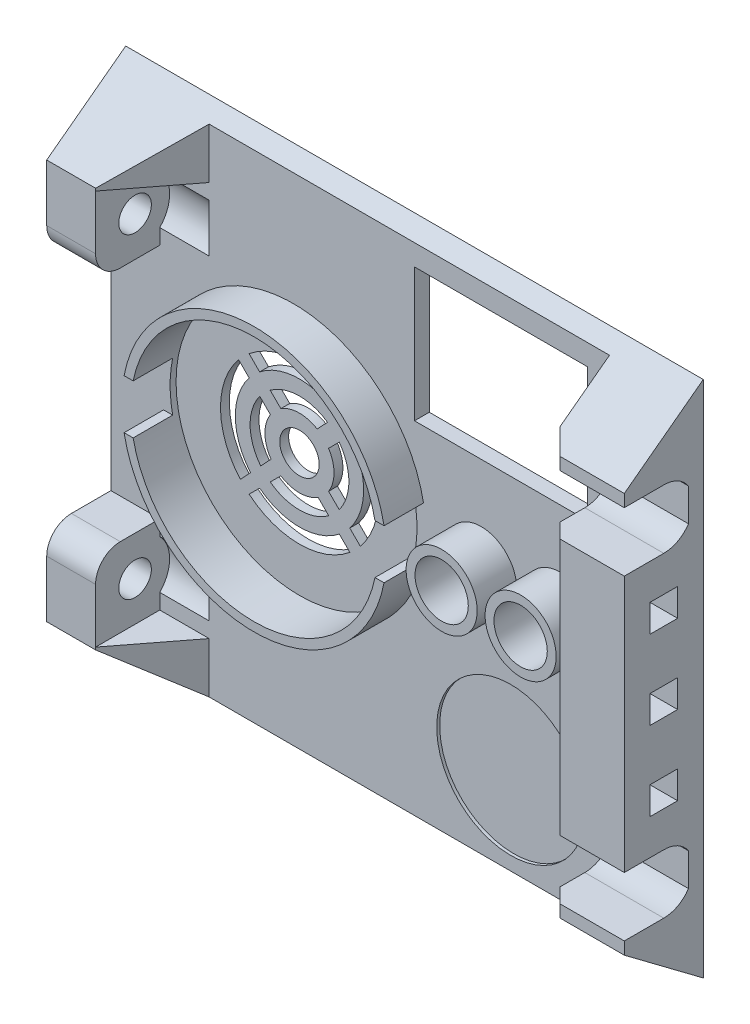
from build123d import *
from build123d.topology import SkipClean

# Parameters (mm, degrees)
ESBO_O1_R                 = 8.3
RESSALTO_EXTRUS_O1_DEPTH  = 1.5
RESSALTO_EXTRUS_O2_DEPTH  = 6
ESBO_O3_W                 = 2.8
ESBO_O3_H                 = 2.8
CORTE_EXTRUS_O1_DEPTH     = 37.142080737
ESBO_O4_W                 = 2.8
ESBO_O4_H                 = 2.8
CORTE_EXTRUS_O2_DEPTH     = 53.08166664
ESBO_O6_W                 = 5
ESBO_O6_H                 = 25
RESSALTO_EXTRUS_O5_DEPTH  = 7.5
ESBO_O7_W                 = 2.8
ESBO_O7_H                 = 2.8
CORTE_EXTRUS_O3_DEPTH     = 60
RESSALTO_EXTRUS_O3_DEPTH  = 10
ESBO_O8_W                 = 60
ESBO_O8_H                 = 52.5
ESBO_O8_R                 = 8.3
RESSALTO_EXTRUS_O6_DEPTH  = 1.5
CORTE_EXTRUS_O4_DEPTH     = 42.098205557
RESSALTO_EXTRUS_O7_DEPTH  = 6.5
ESBO_O14_W                = 5.7
ESBO_O14_H                = 52.5
CORTE_EXTRUS_O8_DEPTH     = 4.5
CORTE_EXTRUS_O9_DEPTH     = 41.657871317
CORTE_EXTRUS_O13_DEPTH    = 6.25
CORTE_EXTRUS_O14_DEPTH    = 6.25
ESBO_O12_R                = 1.65
CORTE_EXTRUS_O15_DEPTH    = 4.5
CORTE_EXTRUS_O17_DEPTH    = 62.398717413
ESBO_O20_R                = 3.5
CORTE_EXTRUS_O18_DEPTH    = 5
RESSALTO_EXTRUS_O8_START  = 2.95
ESBO_O21_R                = 1.65
RESSALTO_EXTRUS_O8_DEPTH  = 2.95
ESBO_O22_W                = 2.8
ESBO_O22_H                = 2.8
RESSALTO_EXTRUS_O9_DEPTH  = 1.25
CORTE_EXTRUS_O19_DEPTH    = 6
ESBO_O24_W                = 8
ESBO_O24_H                = 50.25
RESSALTO_EXTRUS_O10_DEPTH = 6.5
CORTE_EXTRUS_O20_DEPTH    = 62.222570389
CORTE_EXTRUS_O21_REACH    = 67.143
ESBO_O26_W                = 2.8
ESBO_O26_H                = 2.8
CORTE_EXTRUS_O22_REACH    = 67.143
CORTE_EXTRUS_O23_DEPTH    = 6.5
CORTE_EXTRUS_O24_DEPTH    = 6.5
CORTE_EXTRUS_O25_START    = -6.5
CORTE_EXTRUS_O25_DEPTH    = 6.5
CORTE_EXTRUS_O26_DEPTH    = 4.95
ESBO_O33_R                = 9.3
CORTE_EXTRUS_O27_DEPTH    = 43.019340785
ESBO_O34_R                = 8.3
RESSALTO_EXTRUS_O11_DEPTH = 1.5
RESSALTO_EXTRUS_O12_DEPTH = 4
CORTE_EXTRUS_O31_DEPTH    = 42.326444318
CORTE_EXTRUS_O32_START    = -0.6
ESBO_O42_R                = 12.5
CORTE_EXTRUS_O32_DEPTH    = 0.6
ESBO_O43_W                = 17.5
ESBO_O43_H                = 13.5
CORTE_EXTRUS_O33_DEPTH    = 42.326444318
ESBO_O44_R                = 7.5
CORTE_EXTRUS_O34_DEPTH    = 0.3
ESBO_O45_R                = 2.7
CORTE_EXTRUS_O35_DEPTH    = 42.326444318
ESBO_O46_R                = 3
CORTE_EXTRUS_O36_DEPTH    = 42.374690331
CHANFRO1_SIZE             = 1
ESBO_O47_R                = 3
RESSALTO_EXTRUS_O13_DEPTH = 1.2
CHANFRO2_SIZE             = 1
RESSALTO_EXTRUS_O14_START = 4
ESBO_O48_R                = 3.6
ESBO_O48_R_2              = 2.7
RESSALTO_EXTRUS_O14_DEPTH = 4


with BuildPart() as part:
    # Esboço1 → Ressalto-extrusão1 (new body)
    with BuildSketch(Plane.XY):
        Polygon((-25, -12.5), (-25, 12.5), (25, 12.5), (25, -12.5), (15, -12.5), (-15, -12.5), align=None)
        with Locations((-13, 0)):
            Circle(ESBO_O1_R, mode=Mode.SUBTRACT)
        with Locations(Location((13, 0, 0), (0, 0, 180))):
            Circle(ESBO_O1_R, mode=Mode.SUBTRACT)
    extrude(amount=RESSALTO_EXTRUS_O1_DEPTH)

    # Esboço2 → Ressalto-extrusão2 (add)
    with BuildSketch(Plane.XY.offset(1.5)):
        Polygon((-20, -12.5), (-25, -12.5), (-25, -2.5), (-22, -2.5), (-22, -9.5), (-15, -9.5), (-15, -12.5), align=None)
        Polygon((22, -2.5), (22, -9.5), (15, -9.5), (15, -12.5), (20, -12.5), (25, -12.5), (25, -2.5), align=None)
        Polygon((20, 12.5), (25, 12.5), (25, 2.5), (22, 2.5), (22, 9.5), (15, 9.5), (15, 12.5), align=None)
        Polygon((-22, 2.5), (-22, 9.5), (-15, 9.5), (-15, 12.5), (-20, 12.5), (-25, 12.5), (-25, 2.5), align=None)
    extrude(amount=RESSALTO_EXTRUS_O2_DEPTH)

    # Esboço3 → Corte-extrusão1 (cut, through all)
    with BuildSketch(Plane.XZ.offset(12.5)):
        with Locations((-20, 3.75)):
            Rectangle(ESBO_O3_W, ESBO_O3_H)
        with Locations((20, 3.75)):
            Rectangle(ESBO_O3_W, ESBO_O3_H)
    extrude(amount=-CORTE_EXTRUS_O1_DEPTH, mode=Mode.SUBTRACT)

    # Esboço4 → Corte-extrusão2 (cut, through all)
    with BuildSketch(Plane.ZY.offset(25)):
        with Locations((3.75, 7.5)):
            Rectangle(ESBO_O4_W, ESBO_O4_H)
        with Locations((3.75, -7.5)):
            Rectangle(ESBO_O4_W, ESBO_O4_H)
    extrude(amount=-CORTE_EXTRUS_O2_DEPTH, mode=Mode.SUBTRACT)

    # Esboço6 → Ressalto-extrusão5 (add)
    with BuildSketch(Plane(origin=(0, 0, 0), x_dir=(-1, 0, 0), z_dir=(0, 0, -1))):
        with Locations((-27.5, 0)):
            Rectangle(ESBO_O6_W, ESBO_O6_H)
        with Locations((27.5, 0)):
            Rectangle(ESBO_O6_W, ESBO_O6_H)
    extrude(amount=-RESSALTO_EXTRUS_O5_DEPTH)

    # Esboço7 → Corte-extrusão3 (cut)
    with BuildSketch(Plane(origin=(30, 0, 0), x_dir=(0, 0, -1), z_dir=(1, 0, 0))):
        with Locations((-3.75, -7.5)):
            Rectangle(ESBO_O7_W, ESBO_O7_H)
        with Locations((-3.75, 7.5)):
            Rectangle(ESBO_O7_W, ESBO_O7_H)
    extrude(amount=-CORTE_EXTRUS_O3_DEPTH, mode=Mode.SUBTRACT)

    # Esboço5 → Ressalto-extrusão3 (add)
    with SkipClean():  # the faces are left unmerged after this step: merging them gives an invalid solid
        with BuildSketch(Plane.XY.offset(1.5)):
            with BuildLine():
                Line((-9, -7.272551134), (-9, -8.395832299))
                ThreePointArc((-9, -8.395832299), (-3.7, 0), (-9, 8.395832299))
                Line((-9, 8.395832299), (-9, 7.272551134))
                ThreePointArc((-9, 7.272551134), (-4.7, 0), (-9, -7.272551134))
            make_face()
            with BuildLine():
                Line((-17, -7.272551134), (-17, -8.395832299))
                ThreePointArc((-17, -8.395832299), (-22.3, 0), (-17, 8.395832299))
                Line((-17, 8.395832299), (-17, 7.272551134))
                ThreePointArc((-17, 7.272551134), (-21.3, 0), (-17, -7.272551134))
            make_face()
            with BuildLine():
                Line((9, -7.272551134), (9, -8.395832299))
                ThreePointArc((9, -8.395832299), (3.7, 0), (9, 8.395832299))
                Line((9, 8.395832299), (9, 7.272551134))
                ThreePointArc((9, 7.272551134), (4.7, 0), (9, -7.272551134))
            make_face()
            with BuildLine():
                Line((17, 8.395832299), (17, 7.272551134))
                ThreePointArc((17, 7.272551134), (21.3, 0), (17, -7.272551134))
                Line((17, -7.272551134), (17, -8.395832299))
                ThreePointArc((17, -8.395832299), (22.3, 0), (17, 8.395832299))
            make_face()
        extrude(amount=RESSALTO_EXTRUS_O3_DEPTH)

    # Esboço8 → Ressalto-extrusão6 (add)
    with SkipClean():  # the faces are left unmerged after this step: merging them gives an invalid solid
        with BuildSketch(Plane(origin=(0, 0, 0), x_dir=(-1, 0, 0), z_dir=(0, 0, -1))):
            Rectangle(ESBO_O8_W, ESBO_O8_H)
            with Locations(Location((13, 0, 0), (0, 0, 298.811379709))):
                Circle(ESBO_O8_R, mode=Mode.SUBTRACT)
            with Locations((-13, 0)):
                Circle(ESBO_O8_R, mode=Mode.SUBTRACT)
        extrude(amount=-RESSALTO_EXTRUS_O6_DEPTH)

    # Esboço9 → Corte-extrusão4 (cut, through all)
    with SkipClean():  # the faces are left unmerged after this step: merging them gives an invalid solid
        with BuildSketch(Plane.XY.offset(1.5)):
            Polygon((-15, -12.5), (-15, -9.5), (-22, -9.5), (-22, -2.5), (-25, -2.5), (-25, 2.5), (-22, 2.5), (-22, 9.5), (-15, 9.5), (-15, 12.5), (-30, 12.5), (-30, -12.5), align=None)
        extrude(amount=CORTE_EXTRUS_O4_DEPTH, mode=Mode.SUBTRACT)

    # Esboço10 → Ressalto-extrusão7 (add)
    with SkipClean():  # the faces are left unmerged after this step: merging them gives an invalid solid
        with BuildSketch(Plane.XY.offset(1.5)):
            Polygon((-24.3, -26.25), (-24.3, 26.25), (-22.3, 26.25), (-17.3, 26.25), (-17.3, 20), (-22.3, 20), (-22.3, 12), (-17.3, 12), (-17.3, -12), (-22.3, -12), (-22.3, -20), (-17.3, -20), (-17.3, -26.25), (-22.3, -26.25), align=None)
        extrude(amount=RESSALTO_EXTRUS_O7_DEPTH)

    # Esboço14 → Corte-extrusão8 (cut)
    with SkipClean():  # the faces are left unmerged after this step: merging them gives an invalid solid
        with BuildSketch(Plane.XY.offset(1.5)):
            with Locations((-27.15, 0)):
                Rectangle(ESBO_O14_W, ESBO_O14_H)
        extrude(amount=-CORTE_EXTRUS_O8_DEPTH, mode=Mode.SUBTRACT)

    # Esboço15 → Corte-extrusão9 (cut, through all)
    with SkipClean():  # the faces are left unmerged after this step: merging them gives an invalid solid
        with BuildSketch(Plane.XY.offset(8)):
            with BuildLine():
                Line((-17.3, -7.09929574), (-17.3, 7.09929574))
                ThreePointArc((-17.3, 7.09929574), (-21.3, 0), (-17.3, -7.09929574))
            make_face()
        extrude(amount=-CORTE_EXTRUS_O9_DEPTH, mode=Mode.SUBTRACT)

    # Esboço11 → Corte-extrusão13 (cut)
    with SkipClean():  # the faces are left unmerged after this step: merging them gives an invalid solid
        with BuildSketch(Plane.XZ.offset(26.25)):
            Polygon((-22.3, 8), (-17.3, 8), (-17.3, 1.5), align=None)
        extrude(amount=-CORTE_EXTRUS_O13_DEPTH, mode=Mode.SUBTRACT)

    # Esboço17 → Corte-extrusão14 (cut)
    with SkipClean():  # the faces are left unmerged after this step: merging them gives an invalid solid
        with BuildSketch(Plane(origin=(0, 26.25, 0), x_dir=(1, 0, 0), z_dir=(0, 1, 0))):
            Polygon((-17.3, -1.5), (-17.3, -8), (-22.3, -8), align=None)
        extrude(amount=-CORTE_EXTRUS_O14_DEPTH, mode=Mode.SUBTRACT)

    # Esboço12 → Corte-extrusão15 (cut)
    with SkipClean():  # the faces are left unmerged after this step: merging them gives an invalid solid
        with BuildSketch(Plane.ZY.offset(24.3)):
            with Locations(Location((4, 16, 0), (0, 0, 270))):
                Circle(ESBO_O12_R)
            with Locations((4, -16)):
                Circle(ESBO_O12_R)
        extrude(amount=-CORTE_EXTRUS_O15_DEPTH, mode=Mode.SUBTRACT)

    # Esboço19 → Corte-extrusão17 (cut, through all)
    with SkipClean():  # the faces are left unmerged after this step: merging them gives an invalid solid
        with BuildSketch(Plane.ZY.offset(24.3)):
            Polygon((0, 26.25), (8, 26.25), (8, 20.25), align=None)
            Polygon((8, -20.25), (0, -26.25), (8, -26.25), align=None)
        extrude(amount=-CORTE_EXTRUS_O17_DEPTH, mode=Mode.SUBTRACT)

    # Esboço20 → Corte-extrusão18 (cut)
    with SkipClean():  # the faces are left unmerged after this step: merging them gives an invalid solid
        with BuildSketch(Plane(origin=(-22.3, 0, 0), x_dir=(0, 0, -1), z_dir=(1, 0, 0))):
            with Locations((-4, -16)):
                Circle(ESBO_O20_R)
            with Locations((-4, 16)):
                Circle(ESBO_O20_R)
        extrude(amount=CORTE_EXTRUS_O18_DEPTH, mode=Mode.SUBTRACT)

    # Esboço21 → Ressalto-extrusão8 (add)
    with SkipClean():  # the faces are left unmerged after this step: merging them gives an invalid solid
        with BuildSketch(Plane.ZY.offset(24.3).offset(RESSALTO_EXTRUS_O8_START)):
            Polygon((0, 26.25), (0, -26.25), (8, -20.25), (8, 20.25), align=None)
            with Locations(Location((4, -16, 0), (0, 0, 270))):
                Circle(ESBO_O21_R, mode=Mode.SUBTRACT)
            with Locations(Location((4, 16, 0), (0, 0, 270))):
                Circle(ESBO_O21_R, mode=Mode.SUBTRACT)
        extrude(amount=-RESSALTO_EXTRUS_O8_DEPTH)

    # Esboço22 → Ressalto-extrusão9 (add)
    with SkipClean():  # the faces are left unmerged after this step: merging them gives an invalid solid
        with BuildSketch(Plane(origin=(30, 0, 0), x_dir=(0, 0, -1), z_dir=(1, 0, 0))):
            Polygon((-1.5, -25.125), (0, -26.25), (0, 26.25), (-1.5, 25.125), (-1.5, 12.5), (-7.5, 12.5), (-7.5, -12.5), (-1.5, -12.5), align=None)
            with Locations((-3.75, -7.5)):
                Rectangle(ESBO_O22_W, ESBO_O22_H, mode=Mode.SUBTRACT)
            with Locations((-3.75, 7.5)):
                Rectangle(ESBO_O22_W, ESBO_O22_H, mode=Mode.SUBTRACT)
        extrude(amount=RESSALTO_EXTRUS_O9_DEPTH)

    # Esboço23 → Corte-extrusão19 (cut)
    with SkipClean():  # the faces are left unmerged after this step: merging them gives an invalid solid
        with BuildSketch(Plane.XY.offset(7.5)):
            Polygon((25, -2.5), (22, -2.5), (22, -9.5), (15, -9.5), (15, -12.5), (31.25, -12.5), (31.25, 12.5), (15, 12.5), (15, 9.5), (22, 9.5), (22, 2.5), (25, 2.5), align=None)
        extrude(amount=-CORTE_EXTRUS_O19_DEPTH, mode=Mode.SUBTRACT)

    # Esboço24 → Ressalto-extrusão10 (add)
    with SkipClean():  # the faces are left unmerged after this step: merging them gives an invalid solid
        with BuildSketch(Plane.XY.offset(1.5)):
            with Locations((27.25, 0)):
                Rectangle(ESBO_O24_W, ESBO_O24_H)
        extrude(amount=RESSALTO_EXTRUS_O10_DEPTH)

    # Esboço25 → Corte-extrusão20 (cut, through all)
    with SkipClean():  # the faces are left unmerged after this step: merging them gives an invalid solid
        with BuildSketch(Plane(origin=(0, 25.125, 0), x_dir=(1, 0, 0), z_dir=(0, 1, 0))):
            Polygon((23.25, -6.5), (23.25, -8), (24.75, -8), align=None)
        extrude(amount=-CORTE_EXTRUS_O20_DEPTH, mode=Mode.SUBTRACT)

    # Esboço26 → Corte-extrusão21 (cut, up to next)
    with BuildSketch(Plane(origin=(31.25, 0, 0), x_dir=(0, 0, -1), z_dir=(1, 0, 0)), mode=Mode.PRIVATE) as corte_extrus_o21_sk1:
        with Locations((-4, 0)):
            Rectangle(ESBO_O26_W, ESBO_O26_H)
    corte_extrus_o21_tool1 = extrude(corte_extrus_o21_sk1.sketch, amount=-CORTE_EXTRUS_O21_REACH, mode=Mode.PRIVATE) & part.part
    # Esboço26 → Corte-extrusão21 (cut, up to next)
    with BuildSketch(Plane(origin=(31.25, 0, 0), x_dir=(0, 0, -1), z_dir=(1, 0, 0)), mode=Mode.PRIVATE) as corte_extrus_o21_sk2:
        with Locations((-4, -8)):
            Rectangle(ESBO_O26_W, ESBO_O26_H)
    corte_extrus_o21_tool2 = extrude(corte_extrus_o21_sk2.sketch, amount=-CORTE_EXTRUS_O21_REACH, mode=Mode.PRIVATE) & part.part
    # Esboço26 → Corte-extrusão21 (cut, up to next)
    with BuildSketch(Plane(origin=(31.25, 0, 0), x_dir=(0, 0, -1), z_dir=(1, 0, 0)), mode=Mode.PRIVATE) as corte_extrus_o21_sk3:
        with Locations((-4, 8)):
            Rectangle(ESBO_O26_W, ESBO_O26_H)
    corte_extrus_o21_tool3 = extrude(corte_extrus_o21_sk3.sketch, amount=-CORTE_EXTRUS_O21_REACH, mode=Mode.PRIVATE) & part.part
    add(corte_extrus_o21_tool1.solids().sort_by_distance((31.25, 0, 4))[0], mode=Mode.SUBTRACT)
    add(corte_extrus_o21_tool2.solids().sort_by_distance((31.25, -8, 4))[0], mode=Mode.SUBTRACT)
    add(corte_extrus_o21_tool3.solids().sort_by_distance((31.25, 8, 4))[0], mode=Mode.SUBTRACT)

    # Esboço27 → Corte-extrusão22 (cut, up to next)
    with BuildSketch(Plane(origin=(31.25, 0, 0), x_dir=(0, 0, -1), z_dir=(1, 0, 0)), mode=Mode.PRIVATE) as corte_extrus_o22_sk1:
        with BuildLine():
            Line((-4, 19), (-8, 19))
            Line((-8, 19), (-8, 13))
            Line((-8, 13), (-4, 13))
            ThreePointArc((-4, 13), (-2.581362835, 13.356617963), (-1.5, 14.341687605))
            Line((-1.5, 14.341687605), (-1.5, 17.658312395))
            ThreePointArc((-1.5, 17.658312395), (-2.581362835, 18.643382037), (-4, 19))
        make_face()
    corte_extrus_o22_tool1 = extrude(corte_extrus_o22_sk1.sketch, amount=-CORTE_EXTRUS_O22_REACH, mode=Mode.PRIVATE) & part.part
    # Esboço27 → Corte-extrusão22 (cut, up to next)
    with BuildSketch(Plane(origin=(31.25, 0, 0), x_dir=(0, 0, -1), z_dir=(1, 0, 0)), mode=Mode.PRIVATE) as corte_extrus_o22_sk2:
        Polygon((-8, -20.25), (-8, -25.125), (-1.5, -25.125), align=None)
    corte_extrus_o22_tool2 = extrude(corte_extrus_o22_sk2.sketch, amount=-CORTE_EXTRUS_O22_REACH, mode=Mode.PRIVATE) & part.part
    # Esboço27 → Corte-extrusão22 (cut, up to next)
    with BuildSketch(Plane(origin=(31.25, 0, 0), x_dir=(0, 0, -1), z_dir=(1, 0, 0)), mode=Mode.PRIVATE) as corte_extrus_o22_sk3:
        Polygon((-8, 25.125), (-8, 20.25), (-1.5, 25.125), align=None)
    corte_extrus_o22_tool3 = extrude(corte_extrus_o22_sk3.sketch, amount=-CORTE_EXTRUS_O22_REACH, mode=Mode.PRIVATE) & part.part
    # Esboço27 → Corte-extrusão22 (cut, up to next)
    with BuildSketch(Plane(origin=(31.25, 0, 0), x_dir=(0, 0, -1), z_dir=(1, 0, 0)), mode=Mode.PRIVATE) as corte_extrus_o22_sk4:
        with BuildLine():
            Line((-4, -13), (-8, -13))
            Line((-8, -13), (-8, -19))
            Line((-8, -19), (-4, -19))
            ThreePointArc((-4, -19), (-2.581362835, -18.643382037), (-1.5, -17.658312395))
            Line((-1.5, -17.658312395), (-1.5, -14.341687605))
            ThreePointArc((-1.5, -14.341687605), (-2.581362835, -13.356617963), (-4, -13))
        make_face()
    corte_extrus_o22_tool4 = extrude(corte_extrus_o22_sk4.sketch, amount=-CORTE_EXTRUS_O22_REACH, mode=Mode.PRIVATE) & part.part
    add(corte_extrus_o22_tool1.solids().sort_by_distance((31.25, 16, 4.892695))[0], mode=Mode.SUBTRACT)
    add(corte_extrus_o22_tool2.solids().sort_by_distance((31.25, -23.5, 5.833333))[0], mode=Mode.SUBTRACT)
    add(corte_extrus_o22_tool3.solids().sort_by_distance((31.25, 23.5, 5.833333))[0], mode=Mode.SUBTRACT)
    add(corte_extrus_o22_tool4.solids().sort_by_distance((31.25, -16, 4.892695))[0], mode=Mode.SUBTRACT)

    # Esboço28 → Corte-extrusão23 (cut)
    with SkipClean():  # the faces are left unmerged after this step: merging them gives an invalid solid
        with BuildSketch(Plane.XY.offset(8)):
            with BuildLine():
                Line((-27.25, 12), (-27.25, -12))
                Line((-27.25, -12), (-24.8, -12))
                ThreePointArc((-24.8, -12), (-23.032233047, -11.267766953), (-22.3, -9.5))
                Line((-22.3, -9.5), (-22.3, 9.5))
                ThreePointArc((-22.3, 9.5), (-23.032233047, 11.267766953), (-24.8, 12))
                Line((-24.8, 12), (-27.25, 12))
            make_face()
        extrude(amount=-CORTE_EXTRUS_O23_DEPTH, mode=Mode.SUBTRACT)

    # Esboço29 → Corte-extrusão24 (cut)
    with SkipClean():  # the faces are left unmerged after this step: merging them gives an invalid solid
        with BuildSketch(Plane.XY.offset(8)):
            with BuildLine():
                Line((-19.8, -12), (-19.8, -12.44923286))
                Line((-19.8, -12.44923286), (-19.8, -14.139655276))
                Line((-19.8, -14.139655276), (-15.225886581, -14.139655276))
                Line((-15.225886581, -14.139655276), (-15.225886581, -9.5))
                Line((-15.225886581, -9.5), (-17.3, -9.5))
                ThreePointArc((-17.3, -9.5), (-18.032233047, -11.267766953), (-19.8, -12))
            make_face()
            with BuildLine():
                Line((-19.8, 12), (-19.8, 12.907103379))
                Line((-19.8, 12.907103379), (-15.750500434, 12.907103379))
                Line((-15.750500434, 12.907103379), (-15.750500434, 9.5))
                Line((-15.750500434, 9.5), (-17.3, 9.5))
                ThreePointArc((-17.3, 9.5), (-18.032233047, 11.267766953), (-19.8, 12))
            make_face()
        extrude(amount=-CORTE_EXTRUS_O24_DEPTH, mode=Mode.SUBTRACT)

    # Esboço30 → Corte-extrusão25 (cut)
    with SkipClean():  # the faces are left unmerged after this step: merging them gives an invalid solid
        with BuildSketch(Plane.XY.offset(8).offset(CORTE_EXTRUS_O25_START)):
            with BuildLine():
                Line((-27.25, 12), (-17, 12))
                Line((-17, 12), (-17, 8.395832299))
                ThreePointArc((-17, 8.395832299), (-22.3, 0), (-17, -8.395832299))
                Line((-17, -8.395832299), (-17, -12))
                Line((-17, -12), (-27.25, -12))
                Line((-27.25, -12), (-27.25, 12))
            make_face()
        extrude(amount=CORTE_EXTRUS_O25_DEPTH, mode=Mode.SUBTRACT)

    # Esboço31 → Corte-extrusão26 (cut)
    with SkipClean():  # the faces are left unmerged after this step: merging them gives an invalid solid
        with BuildSketch(Plane.ZY.offset(27.25)):
            with BuildLine():
                Line((5.5, -12), (8, -12))
                Line((8, -12), (8, -14.5))
                ThreePointArc((8, -14.5), (7.267766953, -12.732233047), (5.5, -12))
            make_face()
            with BuildLine():
                Line((5.5, 12), (8, 12))
                Line((8, 12), (8, 14.5))
                ThreePointArc((8, 14.5), (7.267766953, 12.732233047), (5.5, 12))
            make_face()
        extrude(amount=-CORTE_EXTRUS_O26_DEPTH, mode=Mode.SUBTRACT)

    # Esboço33 → Corte-extrusão27 (cut, through all)
    with BuildSketch(Plane.XY.offset(1.5)):
        with Locations((13, 0)):
            Circle(ESBO_O33_R)
        with Locations((-13, 0)):
            Circle(ESBO_O33_R)
    extrude(amount=CORTE_EXTRUS_O27_DEPTH, mode=Mode.SUBTRACT)

    # Esboço34 → Ressalto-extrusão11 (add)
    with BuildSketch(Plane(origin=(0, 0, 0), x_dir=(-1, 0, 0), z_dir=(0, 0, -1))):
        with Locations((-13, 0)):
            Circle(ESBO_O34_R)
        with Locations((13, 0)):
            Circle(ESBO_O34_R)
    extrude(amount=-RESSALTO_EXTRUS_O11_DEPTH)

    # Esboço35 → Ressalto-extrusão12 (add)
    with BuildSketch(Plane.XY.offset(1.5)):
        with BuildLine():
            Line((3.497448714, -2.25), (4.414725595, -2.25))
            ThreePointArc((4.414725595, -2.25), (-8.75, -13.15), (-21.914725595, -2.25))
            Line((-21.914725595, -2.25), (-20.997448714, -2.25))
            ThreePointArc((-20.997448714, -2.25), (-8.75, -12.25), (3.497448714, -2.25))
        make_face()
        with BuildLine():
            Line((-21.914725595, 2.75), (-20.997448714, 2.75))
            ThreePointArc((-20.997448714, 2.75), (-8.75, 12.75), (3.497448714, 2.75))
            Line((3.497448714, 2.75), (4.414725595, 2.75))
            ThreePointArc((4.414725595, 2.75), (-8.75, 13.65), (-21.914725595, 2.75))
        make_face()
    extrude(amount=RESSALTO_EXTRUS_O12_DEPTH)

    # Esboço37 → Corte-extrusão31 (cut, through all)
    with BuildSketch(Plane.XY.offset(1.5)):
        with BuildLine():
            ThreePointArc((-10.591004853, 1.031473693), (-10.749669201, 0.213625746), (-10.561366127, -0.597910816))
            Line((-10.561366127, -0.597910816), (-9.787440649, 0.227909489))
            Line((-9.787440649, 0.227909489), (-10.591004853, 1.031473693))
        make_face()
        with BuildLine():
            Line((-10.591004853, 1.031473693), (-9.787440649, 0.227909489))
            Line((-9.787440649, 0.227909489), (-8.761187679, 1.322976863))
            Line((-8.761187679, 1.322976863), (-9.529887973, 2.091677157))
            ThreePointArc((-9.529887973, 2.091677157), (-10.163604487, 1.664822375), (-10.591004853, 1.031473693))
        make_face()
        with BuildLine():
            Line((-9.787440649, 0.227909489), (-10.561366127, -0.597910816))
            ThreePointArc((-10.561366127, -0.597910816), (-10.137698974, -1.190240104), (-9.530041031, -1.591612334))
            Line((-9.530041031, -1.591612334), (-8.748979928, -0.810551231))
            Line((-8.748979928, -0.810551231), (-9.787440649, 0.227909489))
        make_face()
        Polygon((-8.761187679, 1.322976863), (-9.787440649, 0.227909489), (-8.748979928, -0.810551231), (-7.688319756, 0.25010894), align=None)
        with BuildLine():
            Line((-7.688319756, 0.25010894), (-8.748979928, -0.810551231))
            Line((-8.748979928, -0.810551231), (-7.968526307, -1.591004853))
            ThreePointArc((-7.968526307, -1.591004853), (-7.335177625, -1.163604487), (-6.908322843, -0.529887973))
            Line((-6.908322843, -0.529887973), (-7.688319756, 0.25010894))
        make_face()
        with BuildLine():
            Line((-8.021267648, 2.112511519), (-8.761187679, 1.322976863))
            Line((-8.761187679, 1.322976863), (-7.688319756, 0.25010894))
            Line((-7.688319756, 0.25010894), (-6.908387666, 1.030041031))
            ThreePointArc((-6.908387666, 1.030041031), (-7.355509577, 1.683665393), (-8.021267648, 2.112511519))
        make_face()
        with BuildLine():
            Line((-6.908387666, 1.030041031), (-7.688319756, 0.25010894))
            Line((-7.688319756, 0.25010894), (-6.908322843, -0.529887973))
            ThreePointArc((-6.908322843, -0.529887973), (-6.789980317, -0.147898031), (-6.75, 0.25))
            ThreePointArc((-6.75, 0.25), (-6.789996854, 0.647979479), (-6.908387666, 1.030041031))
        make_face()
        with BuildLine():
            Line((-8.748979928, -0.810551231), (-9.530041031, -1.591612334))
            ThreePointArc((-9.530041031, -1.591612334), (-8.749221933, -1.749999849), (-7.968526307, -1.591004853))
            Line((-7.968526307, -1.591004853), (-8.748979928, -0.810551231))
        make_face()
        with BuildLine():
            Line((-9.529887973, 2.091677157), (-8.761187679, 1.322976863))
            Line((-8.761187679, 1.322976863), (-8.021267648, 2.112511519))
            ThreePointArc((-8.021267648, 2.112511519), (-8.777617785, 2.249809305), (-9.529887973, 2.091677157))
        make_face()
        with BuildLine():
            ThreePointArc((-12.775384042, 3.215852882), (-13.749281334, 0.165228883), (-12.672516873, -2.850622741))
            Line((-12.672516873, -2.850622741), (-11.630265621, -1.738484335))
            ThreePointArc((-11.630265621, -1.738484335), (-12.249477141, 0.189504233), (-11.697274304, 2.137743144))
            Line((-11.697274304, 2.137743144), (-12.775384042, 3.215852882))
        make_face()
        with BuildLine():
            Line((-5.801844369, -1.636366447), (-4.723658236, -2.71455258))
            ThreePointArc((-4.723658236, -2.71455258), (-3.999646917, -1.310174859), (-3.75, 0.25))
            ThreePointArc((-3.75, 0.25), (-3.99967123, 1.810248884), (-4.723750632, 3.214678065))
            Line((-4.723750632, 3.214678065), (-5.801929385, 2.136499311))
            ThreePointArc((-5.801929385, 2.136499311), (-5.390815043, 1.232790122), (-5.25, 0.25))
            ThreePointArc((-5.25, 0.25), (-5.390792898, -0.732714427), (-5.801844369, -1.636366447))
        make_face()
        with BuildLine():
            ThreePointArc((-5.910116902, 4.365223444), (-8.826554609, 5.249413905), (-11.71455258, 4.276341764))
            Line((-11.71455258, 4.276341764), (-10.636366447, 3.198155631))
            ThreePointArc((-10.636366447, 3.198155631), (-8.802180143, 3.749611012), (-6.952368154, 3.253085038))
            Line((-6.952368154, 3.253085038), (-5.910116902, 4.365223444))
        make_face()
        with BuildLine():
            Line((-10.636499311, -2.698070615), (-11.714678065, -3.776249368))
            ThreePointArc((-11.714678065, -3.776249368), (-8.749270448, -4.749999947), (-5.784147118, -3.775384042))
            Line((-5.784147118, -3.775384042), (-6.862256856, -2.697274304))
            ThreePointArc((-6.862256856, -2.697274304), (-8.74926155, -3.249999922), (-10.636499311, -2.698070615))
        make_face()
        with BuildLine():
            Line((-12.784656999, -4.846228302), (-13.851111595, -5.912682898))
            ThreePointArc((-13.851111595, -5.912682898), (-8.74927551, -7.749999967), (-3.647772289, -5.911758871))
            Line((-3.647772289, -5.911758871), (-4.71420445, -4.84532671))
            ThreePointArc((-4.71420445, -4.84532671), (-8.749273851, -6.249999959), (-12.784656999, -4.846228302))
        make_face()
        with BuildLine():
            Line((-3.653675425, -3.784535391), (-2.58721843, -4.850992386))
            ThreePointArc((-2.58721843, -4.850992386), (-1.223305754, -2.460880617), (-0.75, 0.25))
            ThreePointArc((-0.75, 0.25), (-1.223331973, 2.960953413), (-2.587317102, 5.351111595))
            Line((-2.587317102, 5.351111595), (-3.653771698, 4.284656999))
            ThreePointArc((-3.653771698, 4.284656999), (-2.610965713, 2.385944292), (-2.25, 0.25))
            ThreePointArc((-2.25, 0.25), (-2.610940229, -1.885871047), (-3.653675425, -3.784535391))
        make_face()
        with BuildLine():
            ThreePointArc((-3.844418152, 6.569435634), (-8.87522557, 8.24901985), (-13.850992386, 6.41278157))
            Line((-13.850992386, 6.41278157), (-12.784535391, 5.346324575))
            ThreePointArc((-12.784535391, 5.346324575), (-8.850895433, 6.749216884), (-4.875603858, 5.469104764))
            Line((-4.875603858, 5.469104764), (-3.844418152, 6.569435634))
        make_face()
        with BuildLine():
            ThreePointArc((-14.911758871, 5.352227711), (-16.748887939, 0.116614334), (-14.738215624, -5.054834931))
            Line((-14.738215624, -5.054834931), (-13.707029918, -3.954504061))
            ThreePointArc((-13.707029918, -3.954504061), (-15.249084771, 0.140925984), (-13.84532671, 4.28579555))
            Line((-13.84532671, 4.28579555), (-14.911758871, 5.352227711))
        make_face()
    extrude(amount=-CORTE_EXTRUS_O31_DEPTH, mode=Mode.SUBTRACT)

    # Esboço42 → Corte-extrusão32 (cut)
    with BuildSketch(Plane.XY.offset(1.5).offset(CORTE_EXTRUS_O32_START)):
        with Locations(Location((-8.75, 0.25, 0), (0, 0, 191.536959033))):
            Circle(ESBO_O42_R)
    extrude(amount=CORTE_EXTRUS_O32_DEPTH, mode=Mode.SUBTRACT)

    # Esboço43 → Corte-extrusão33 (cut, through all)
    with BuildSketch(Plane.XY.offset(1.5)):
        with Locations((12.25, 16.25)):
            Rectangle(ESBO_O43_W, ESBO_O43_H)
    extrude(amount=-CORTE_EXTRUS_O33_DEPTH, mode=Mode.SUBTRACT)

    # Esboço44 → Corte-extrusão34 (cut)
    with BuildSketch(Plane.XY.offset(1.5)):
        with Locations((13.25, -16.25)):
            Circle(ESBO_O44_R)
    extrude(amount=-CORTE_EXTRUS_O34_DEPTH, mode=Mode.SUBTRACT)

    # Esboço45 → Corte-extrusão35 (cut, through all)
    with BuildSketch(Plane.XY.offset(1.5)):
        with Locations((18.25, 0)):
            Circle(ESBO_O45_R)
        with Locations((10.25, 0)):
            Circle(ESBO_O45_R)
    extrude(amount=-CORTE_EXTRUS_O35_DEPTH, mode=Mode.SUBTRACT)

    # Esboço46 → Corte-extrusão36 (cut, through all)
    with BuildSketch(Plane.XY.offset(1.2)):
        with Locations((13.25, -16.25)):
            Circle(ESBO_O46_R)
    extrude(amount=-CORTE_EXTRUS_O36_DEPTH, mode=Mode.SUBTRACT)

    # Chanfro1
    chanfro1_edges = [part.edges().sort_by_distance(p)[0] for p in [
        (10.25, -16.25, 0),
    ]]
    chamfer(chanfro1_edges, length=CHANFRO1_SIZE)

    # Esboço47 → Ressalto-extrusão13 (add, through all)
    with BuildSketch(Plane.XY.offset(1.2)):
        with Locations((13.25, -16.25)):
            Circle(ESBO_O47_R)
    extrude(amount=-RESSALTO_EXTRUS_O13_DEPTH)

    # Chanfro2
    chanfro2_edges = [part.edges().sort_by_distance(p)[0] for p in [
        (10.25, -16.25, 0),
    ]]
    chamfer(chanfro2_edges, length=CHANFRO2_SIZE - 0.0001)  # a hair under: the kernel refuses the full size

    # Esboço48 → Ressalto-extrusão14 (add)
    # profile 1 of 2: a face of its own
    with BuildSketch(Plane.XY.offset(1.5).offset(RESSALTO_EXTRUS_O14_START)):
        with Locations((10.25, 0)):
            Circle(ESBO_O48_R)
        with Locations((10.25, 0)):
            Circle(ESBO_O48_R_2, mode=Mode.SUBTRACT)
    # profile 2 of 2: a face of its own
    with BuildSketch(Plane.XY.offset(1.5).offset(RESSALTO_EXTRUS_O14_START)):
        with Locations((18.25, 0)):
            Circle(ESBO_O48_R)
        with Locations((18.25, 0)):
            Circle(ESBO_O48_R_2, mode=Mode.SUBTRACT)
    extrude(amount=-RESSALTO_EXTRUS_O14_DEPTH)


solid = part.part
